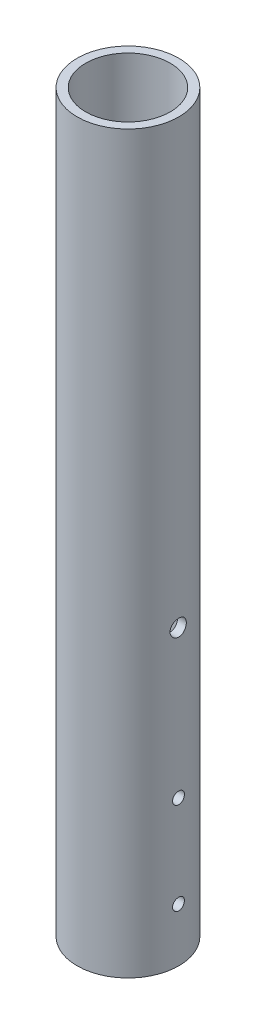
from build123d import *

# Parameters (mm, degrees)
SKETCH1_R                    = 21.082
SKETCH1_R_2                  = 17.526
BOSS_EXTRUDE1_DEPTH          = 304.8
F_10_0_1935_DIAMETER_HOLE1_D = 4.9149
F_1_4_CLEARANCE_HOLE1_D      = 6.7564


with BuildPart() as part:
    # Sketch1 → Boss-Extrude1 (new body)
    with BuildSketch(Plane(origin=(0, 0, 0), x_dir=(1, 0, 0), z_dir=(0, 1, 0))):
        Circle(SKETCH1_R)
        Circle(SKETCH1_R_2, mode=Mode.SUBTRACT)
    extrude(amount=BOSS_EXTRUDE1_DEPTH)

    # #10 (0.1935) Diameter Hole1 (through all)
    with Locations(Plane.ZY.offset(21.082)):
        with Locations((0, 22.225), (0, 60.325)):
            Hole(F_10_0_1935_DIAMETER_HOLE1_D / 2)

    # 1/4 Clearance Hole1 (through all)
    with Locations(Plane(origin=(-21.082, 0, 0), x_dir=(0, 0, -1), z_dir=(-1, 0, 0))):
        with Locations((0, -121.44375)):
            Hole(F_1_4_CLEARANCE_HOLE1_D / 2)


solid = part.part
